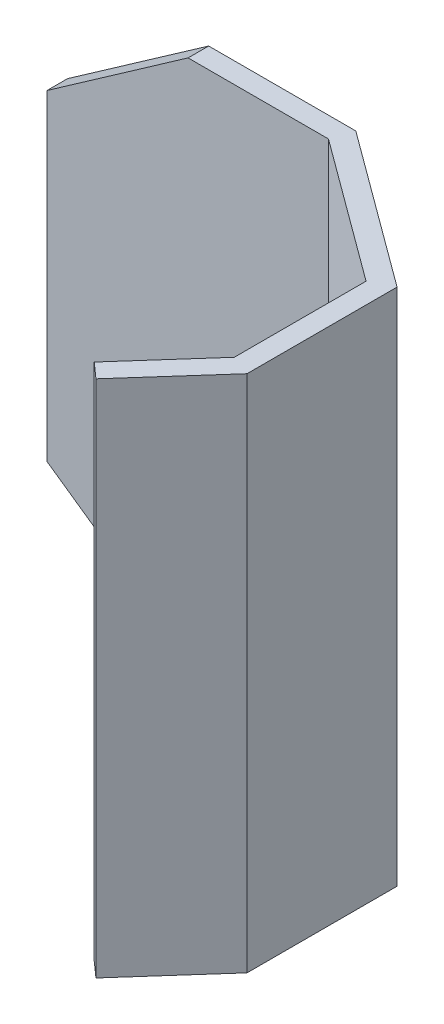
from build123d import *

# Parameters (mm, degrees)
EXTRUDE_1_DEPTH      = 31.5
EXTRUDE_1_DEPTH_BACK = 31.5
CHAMFER_1_SIZE       = 12
CHAMFER_1_SIZE2      = 17.137776081


with BuildPart() as part:
    # 草图1 → 凸台-拉伸1 (new, two sides: drawn at the far end of the back side and taken through both)
    with BuildSketch(Plane(origin=(0, 0, 0), x_dir=(1, 0, 0), z_dir=(0, 1, 0)).offset(-EXTRUDE_1_DEPTH_BACK)):
        Polygon((0, -8), (0, 8), (-17.240931671, 20.67715564), (-51.420742101, 20.67715564), (-51.420742101, 23.17715564), (-16.420742101, 23.17715564), (2.5, 9.264845271), (2.5, -8.950498306), (-6.131476703, -18.660909597), (-8, -17), align=None)
    extrude(amount=EXTRUDE_1_DEPTH + EXTRUDE_1_DEPTH_BACK)

    # 倒角1
    chamfer_1_edges = [part.edges().sort_by_distance(p)[0] for p in [
        (-51.420742101, -31.5, -21.92715564),
        (-51.420742101, 31.5, -21.92715564),
    ]]
    chamfer_1_side = [part.faces().sort_by_distance(p)[0] for p in [
        (-51.420742101, 0, -21.92715564),
    ]]
    chamfer(chamfer_1_edges, length=CHAMFER_1_SIZE, length2=CHAMFER_1_SIZE2, reference=chamfer_1_side[0])


solid = part.part
